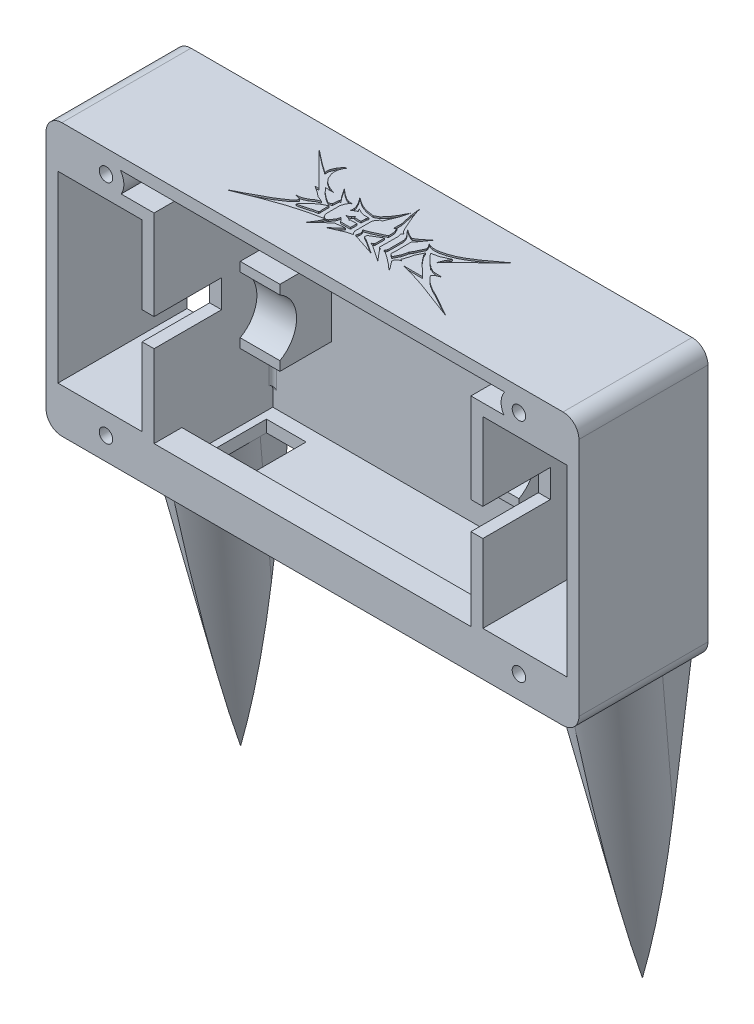
from build123d import *

# Parameters (mm, degrees)
BASE_FOOTPRINT_W                   = 134.2
BASE_FOOTPRINT_H                   = 68.4
UNBROKEN_FLOOR_DEPTH               = 2.6
SHELL_PROFILE_W                    = 134.2
SHELL_PROFILE_H                    = 68.4
SHELL_PROFILE_W_2                  = 128.2
SHELL_PROFILE_H_2                  = 62.4
THREE_MM_PERIMETER_DEPTH           = 32.5
OPEN_WHEEL_WELLS_START             = 36
WHEEL_WELL_PROFILE_W               = 21.2
WHEEL_WELL_PROFILE_H               = 46.2
OPEN_WHEEL_WELLS_DEPTH             = 38
WHEEL_GUARD_PROFILE_W              = 3
WHEEL_GUARD_PROFILE_H              = 46.2
INNER_WHEEL_GUARDS_DEPTH           = 32.5
WHEEL_RETURN_PROFILE_W             = 24.2
WHEEL_RETURN_PROFILE_H             = 3
WHEEL_RETURN_RIBS_DEPTH            = 32.5
OPEN_SHAFT_NOTCHES_START           = 32.5
SHAFT_DROP_IN_PROFILE_W            = 3.7
SHAFT_DROP_IN_PROFILE_H            = 7
OPEN_SHAFT_NOTCHES_DEPTH           = 17
LOWER_CRADLE_BLOCKS_PROFILE_W      = 10
LOWER_CRADLE_BLOCKS_PROFILE_H      = 19
LOWER_MOTOR_CRADLES_DEPTH          = 15.6
LOWER_CRADLE_SEATS_R8P2_START      = 36
LOWER_CRADLE_RADIUS_PROFILE_R      = 8.2
LOWER_CRADLE_SEATS_R8P2_DEPTH      = 72
BATTERY_SIDE_GUIDES_PROFILE_W      = 3
BATTERY_SIDE_GUIDES_PROFILE_H      = 21.2
BATTERY_SIDE_GUIDES_DEPTH          = 5.6
LID_SCREW_BOSS_PROFILE_R           = 4.5
REINFORCED_M3_BOSSES_DEPTH         = 32.5
M3_THROUGH_HOLES_START             = 35.5
M3_THROUGH_HOLES_PROFILE_R         = 1.7
M3_THROUGH_HOLES_DEPTH             = 36
M3_HEX_NUT_POCKETS_UNDERSIDE_START = 2.6
M3_HEX_NUT_POCKETS_UNDERSIDE_DEPTH = 2.7
OUTER_CORNERS_R4_R                 = 4
INNER_CORNERS_R1_R                 = 1
WHEEL_RETURN_ROOT_FILLETS_R1_R     = 1
VIPER_REAR_ENGRAVED_START          = 34.2
VIPER_REAR_ENGRAVED_DEPTH          = 0.4
SKETCH1_W                          = 8.5
SKETCH1_H                          = 5.1
BOSS_EXTRUDE1_DEPTH                = 32.5
BOSS_EXTRUDE2_DEPTH                = 82.5
BOSS_EXTRUDE2_DEPTH_BACK           = 2
SKETCH2_W                          = 7
SKETCH2_H                          = 7
SKETCH3_W                          = 8.5
SKETCH3_H                          = 5.1
BOSS_EXTRUDE5_DEPTH                = 32.5
SKETCH4_W                          = 10
SKETCH4_H                          = 18
CUT_EXTRUDE1_DEPTH                 = 10
BOSS_EXTRUDE7_DEPTH                = 20
CUT_EXTRUDE3_DEPTH                 = 70
CUT_EXTRUDE3_DEPTH_BACK            = 78
FILLET3_R                          = 12.5


with BuildPart() as part:
    # Base_Footprint → Unbroken_Floor (new body)
    with BuildSketch(Plane.XY):
        Rectangle(BASE_FOOTPRINT_W, BASE_FOOTPRINT_H)
    extrude(amount=UNBROKEN_FLOOR_DEPTH)

    # Shell_Profile → Three_mm_Perimeter (add)
    with BuildSketch(Plane.XY):
        Rectangle(SHELL_PROFILE_W, SHELL_PROFILE_H)
        Rectangle(SHELL_PROFILE_W_2, SHELL_PROFILE_H_2, mode=Mode.SUBTRACT)
    extrude(amount=THREE_MM_PERIMETER_DEPTH)

    # Wheel_Well_Profile → Open_Wheel_Wells (cut)
    with BuildSketch(Plane.XY.offset(OPEN_WHEEL_WELLS_START)):
        with Locations((53.5, 0)):
            Rectangle(WHEEL_WELL_PROFILE_W, WHEEL_WELL_PROFILE_H)
        with Locations((-53.5, 0)):
            Rectangle(WHEEL_WELL_PROFILE_W, WHEEL_WELL_PROFILE_H)
    extrude(amount=-OPEN_WHEEL_WELLS_DEPTH, mode=Mode.SUBTRACT)

    # Wheel_Guard_Profile → Inner_Wheel_Guards (add)
    with BuildSketch(Plane.XY):
        with Locations((41.4, 0)):
            Rectangle(WHEEL_GUARD_PROFILE_W, WHEEL_GUARD_PROFILE_H)
        with Locations((-41.4, 0)):
            Rectangle(WHEEL_GUARD_PROFILE_W, WHEEL_GUARD_PROFILE_H)
    extrude(amount=INNER_WHEEL_GUARDS_DEPTH)

    # Wheel_Return_Profile → Wheel_Return_Ribs (add)
    with BuildSketch(Plane.XY):
        with Locations((-52, -24.6)):
            Rectangle(WHEEL_RETURN_PROFILE_W, WHEEL_RETURN_PROFILE_H)
        with Locations((-52, 24.6)):
            Rectangle(WHEEL_RETURN_PROFILE_W, WHEEL_RETURN_PROFILE_H)
        with Locations((52, -24.6)):
            Rectangle(WHEEL_RETURN_PROFILE_W, WHEEL_RETURN_PROFILE_H)
        with Locations((52, 24.6)):
            Rectangle(WHEEL_RETURN_PROFILE_W, WHEEL_RETURN_PROFILE_H)
    extrude(amount=WHEEL_RETURN_RIBS_DEPTH)

    # Shaft_Drop_In_Profile → Open_Shaft_Notches (cut)
    with BuildSketch(Plane.XY.offset(OPEN_SHAFT_NOTCHES_START)):
        with Locations((-41.35, 0)):
            Rectangle(SHAFT_DROP_IN_PROFILE_W, SHAFT_DROP_IN_PROFILE_H)
        with Locations((41.35, 0)):
            Rectangle(SHAFT_DROP_IN_PROFILE_W, SHAFT_DROP_IN_PROFILE_H)
    extrude(amount=-OPEN_SHAFT_NOTCHES_DEPTH, mode=Mode.SUBTRACT)

    # Lower_Cradle_Blocks_Profile → Lower_Motor_Cradles (add)
    with BuildSketch(Plane.XY):
        with Locations((-30.1, 0)):
            Rectangle(LOWER_CRADLE_BLOCKS_PROFILE_W, LOWER_CRADLE_BLOCKS_PROFILE_H)
        with Locations((30.1, 0)):
            Rectangle(LOWER_CRADLE_BLOCKS_PROFILE_W, LOWER_CRADLE_BLOCKS_PROFILE_H)
    extrude(amount=LOWER_MOTOR_CRADLES_DEPTH)

    # Lower_Cradle_Radius_Profile → Lower_Cradle_Seats_R8p2 (cut)
    with BuildSketch(Plane(origin=(0, 0, 0), x_dir=(0, 0, -1), z_dir=(1, 0, 0)).offset(LOWER_CRADLE_SEATS_R8P2_START)):
        with Locations((-19.6, 0)):
            Circle(LOWER_CRADLE_RADIUS_PROFILE_R)
    extrude(amount=-LOWER_CRADLE_SEATS_R8P2_DEPTH, mode=Mode.SUBTRACT)

    # Battery_Side_Guides_Profile → Battery_Side_Guides (add)
    with BuildSketch(Plane.XY):
        with Locations((-30, 20.6)):
            Rectangle(BATTERY_SIDE_GUIDES_PROFILE_W, BATTERY_SIDE_GUIDES_PROFILE_H)
        with Locations((30, 20.6)):
            Rectangle(BATTERY_SIDE_GUIDES_PROFILE_W, BATTERY_SIDE_GUIDES_PROFILE_H)
    extrude(amount=BATTERY_SIDE_GUIDES_DEPTH)

    # Lid_Screw_Boss_Profile → Reinforced_M3_Bosses (add)
    with BuildSketch(Plane.XY):
        with Locations((-52, -28.5)):
            Circle(LID_SCREW_BOSS_PROFILE_R)
        with Locations((-52, 28.5)):
            Circle(LID_SCREW_BOSS_PROFILE_R)
        with Locations((52, -28.5)):
            Circle(LID_SCREW_BOSS_PROFILE_R)
        with Locations((52, 28.5)):
            Circle(LID_SCREW_BOSS_PROFILE_R)
    extrude(amount=REINFORCED_M3_BOSSES_DEPTH)

    # M3_Through_Holes_Profile → M3_Through_Holes (cut)
    with BuildSketch(Plane.XY.offset(M3_THROUGH_HOLES_START)):
        with Locations(Location((-52, -28.5, 0), (0, 0, 180))):
            Circle(M3_THROUGH_HOLES_PROFILE_R)
        with Locations(Location((-52, 28.5, 0), (0, 0, 180))):
            Circle(M3_THROUGH_HOLES_PROFILE_R)
        with Locations(Location((52, -28.5, 0), (0, 0, 180))):
            Circle(M3_THROUGH_HOLES_PROFILE_R)
        with Locations(Location((52, 28.5, 0), (0, 0, 180))):
            Circle(M3_THROUGH_HOLES_PROFILE_R)
    extrude(amount=-M3_THROUGH_HOLES_DEPTH, mode=Mode.SUBTRACT)

    # Captive_Nut_Pockets_Profile → M3_Hex_Nut_Pockets_Underside (cut)
    with BuildSketch(Plane.XY.offset(M3_HEX_NUT_POCKETS_UNDERSIDE_START)):
        Polygon((-48.709103466, -28.5), (-50.354551733, -25.65), (-53.645448267, -25.65), (-55.290896534, -28.5), (-53.645448267, -31.35), (-50.354551733, -31.35), align=None)
        Polygon((-48.709103466, 28.5), (-50.354551733, 31.35), (-53.645448267, 31.35), (-55.290896534, 28.5), (-53.645448267, 25.65), (-50.354551733, 25.65), align=None)
        Polygon((55.290896534, -28.5), (53.645448267, -25.65), (50.354551733, -25.65), (48.709103466, -28.5), (50.354551733, -31.35), (53.645448267, -31.35), align=None)
        Polygon((55.290896534, 28.5), (53.645448267, 31.35), (50.354551733, 31.35), (48.709103466, 28.5), (50.354551733, 25.65), (53.645448267, 25.65), align=None)
    extrude(amount=-M3_HEX_NUT_POCKETS_UNDERSIDE_DEPTH, mode=Mode.SUBTRACT)

    # Outer_Corners_R4
    outer_corners_r4_edges = [part.edges().sort_by_distance(p)[0] for p in [
        (-67.1, 34.2, 16.25),
        (67.1, 34.2, 16.25),
        (67.1, -34.2, 16.25),
        (-67.1, -34.2, 16.25),
    ]]
    fillet(outer_corners_r4_edges, radius=OUTER_CORNERS_R4_R)

    # Inner_Corners_R1
    inner_corners_r1_edges = [part.edges().sort_by_distance(p)[0] for p in [
        (-64.1, -31.2, 17.55),
        (64.1, -31.2, 17.55),
        (64.1, 31.2, 17.55),
        (-64.1, 31.2, 17.55),
    ]]
    fillet(inner_corners_r1_edges, radius=INNER_CORNERS_R1_R)

    # Wheel_Return_Root_Fillets_R1
    wheel_return_root_fillets_r1_edges = [part.edges().sort_by_distance(p)[0] for p in [
        (-39.9, 0, 2.6),
        (39.9, 0, 2.6),
        (-44.046713369, 26.1, 2.6),
        (44.046713369, -26.1, 2.6),
        (59.953286631, 26.1, 2.6),
        (-59.953286631, -26.1, 2.6),
        (-59.953286631, 26.1, 2.6),
        (59.953286631, -26.1, 2.6),
        (44.046713369, 26.1, 2.6),
        (-44.046713369, -26.1, 2.6),
    ]]
    fillet(wheel_return_root_fillets_r1_edges, radius=WHEEL_RETURN_ROOT_FILLETS_R1_R)

    # VIPER_Wordmark_Native_Profile → VIPER_Rear_Engraved (cut)
    # profile 1 of 4: a face of its own
    with BuildSketch(Plane(origin=(0, 0, 0), x_dir=(1, 0, 0), z_dir=(0, 1, 0)).offset(VIPER_REAR_ENGRAVED_START)):
        Polygon((27.5, -26.323476703), (17.406810036, -22.538530466), (13.897849462, -21.434587814), (11.335125448, -20.764336918), (11.295698925, -20.685483871), (15.948028674, -20.685483871), (14.213261649, -18.950716846), (13.543010753, -18.477598566), (12.32078853, -17.137096774), (11.374551971, -15.875448029), (11.098566308, -15.165770609), (10.073476703, -17.215949821), (10.073476703, -17.649641577), (9.5609319, -19.226702509), (9.363799283, -19.581541219), (9.797491039, -19.818100358), (9.797491039, -19.896953405), (9.521505376, -19.936379928), (9.08781362, -20.212365591), (8.772401434, -20.527777778), (8.614695341, -20.843189964), (8.654121864, -21.237455197), (9.758064516, -22.656810036), (10.310035842, -23.445340502), (10.270609319, -23.524193548), (9.127240143, -22.459677419), (7.155913978, -20.922043011), (5.97311828, -20.133512545), (5.224014337, -19.857526882), (5.421146953, -19.620967742), (5.61827957, -19.068996416), (5.61827957, -15.244623656), (5.539426523, -14.850358423), (5.224014337, -14.022401434), (3.686379928, -12.248207885), (5.02688172, -13.155017921), (5.97311828, -13.628136201), (6.249103943, -13.667562724), (7.471326165, -12.879032258), (9.32437276, -11.341397849), (7.668458781, -13.706989247), (6.919354839, -14.57437276), (6.958781362, -18.122759857), (6.879928315, -19.581541219), (7.629032258, -20.251792115), (8.456989247, -18.595878136), (8.85125448, -17.018817204), (9.284946237, -16.309139785), (10.349462366, -14.022401434), (10.191756272, -13.588709677), (9.639784946, -12.721326165), (10.231182796, -12.997311828), (10.901433692, -13.155017921), (12.123655914, -13.155017921), (13.976702509, -12.721326165), (15.711469534, -12.051075269), (17.367383513, -11.183691756), (19.535842294, -9.803763441), (24.26702509, -6.334229391), (20.048387097, -10.474014337), (17.406810036, -12.918458781), (15.593189964, -14.732078853), (14.686379928, -15.836021505), (14.646953405, -15.717741935), (15.080645161, -14.613799283), (15.869175627, -13.155017921), (13.621863799, -14.180107527), (11.768817204, -14.57437276), (13.503584229, -16.466845878), (14.410394265, -17.215949821), (14.725806452, -17.373655914), (15.001792115, -17.767921147), (15.120071685, -17.6890681), (15.908602151, -18.122759857), (16.5, -18.28046595), (18.471326165, -18.359318996), (17.209677419, -18.871863799), (16.815412186, -19.147849462), (16.657706093, -19.384408602), (17.130824373, -20.094086022), (18.550179211, -21.355734767), (20.08781362, -22.301971326), (21.310035842, -22.893369176), align=None)
    # profile 2 of 4: a face of its own
    with BuildSketch(Plane(origin=(0, 0, 0), x_dir=(1, 0, 0), z_dir=(0, 1, 0)).offset(VIPER_REAR_ENGRAVED_START)):
        Polygon((-27.421146953, -26.284050179), (-27.5, -26.284050179), (-27.460573477, -26.205197133), (-25.016129032, -24.98297491), (-19.96953405, -22.22311828), (-17.603942652, -20.646057348), (-16.697132616, -19.778673835), (-16.421146953, -19.344982079), (-16.894265233, -19.108422939), (-18.077060932, -18.793010753), (-17.130824373, -18.753584229), (-16.302867384, -18.556451613), (-15.396057348, -18.122759857), (-14.252688172, -17.334229391), (-13.306451613, -16.979390681), (-14.331541219, -16.506272401), (-14.607526882, -16.466845878), (-15.790322581, -15.520609319), (-17.406810036, -14.495519713), (-16.421146953, -14.495519713), (-24.621863799, -6.255376344), (-24.621863799, -6.176523297), (-24.464157706, -6.255376344), (-21.546594982, -8.542114695), (-19.141577061, -10.237455197), (-19.181003584, -9.409498208), (-19.102150538, -8.975806452), (-18.629032258, -7.871863799), (-18.116487455, -7.16218638), (-17.091397849, -6.176523297), (-17.761648746, -7.359318996), (-18.037634409, -8.187275986), (-18.077060932, -9.251792115), (-17.958781362, -9.803763441), (-17.367383513, -11.22311828), (-16.61827957, -12.051075269), (-15.711469534, -12.681899642), (-14.844086022, -13.115591398), (-13.700716846, -13.509856631), (-14.922939068, -13.549283154), (-15.829749104, -13.391577061), (-14.686379928, -14.613799283), (-13.306451613, -15.717741935), (-12.084229391, -16.466845878), (-11.335125448, -16.112007168), (-11.256272401, -14.613799283), (-11.216845878, -14.45609319), (-10.940860215, -14.416666667), (-11.808243728, -13.312724014), (-13.109318996, -11.380824373), (-11.768817204, -12.484767025), (-10.664874552, -13.233870968), (-9.797491039, -13.588709677), (-8.85125448, -13.628136201), (-9.363799283, -14.10125448), (-9.639784946, -14.495519713), (-9.994623656, -15.520609319), (-9.994623656, -19.147849462), (-9.639784946, -19.896953405), (-9.048387097, -20.330645161), (-12.872759857, -21.158602151), (-16.85483871, -22.301971326), (-21.231182796, -23.839605735), align=None)
        Polygon((-15.908602151, -20.685483871), (-15.790322581, -20.724910394), (-14.568100358, -20.448924731), (-12.399641577, -19.818100358), (-11.374551971, -19.620967742), (-11.256272401, -19.305555556), (-11.335125448, -18.911290323), (-11.335125448, -17.018817204), (-12.636200717, -17.649641577), (-13.818996416, -18.51702509), align=None, mode=Mode.SUBTRACT)
    # profile 3 of 4: a face of its own
    with BuildSketch(Plane(origin=(0, 0, 0), x_dir=(1, 0, 0), z_dir=(0, 1, 0)).offset(VIPER_REAR_ENGRAVED_START)):
        Polygon((-10.586021505, -23.563620072), (-10.625448029, -23.484767025), (-9.44265233, -21.63172043), (-8.85125448, -20.291218638), (-8.575268817, -20.291218638), (-8.378136201, -20.133512545), (-7.550179211, -18.911290323), (-7.274193548, -18.004480287), (-6.367383513, -19.029569892), (-3.922939068, -19.029569892), (-3.922939068, -17.373655914), (-5.578853047, -17.413082437), (-5.61827957, -17.767921147), (-5.775985663, -17.531362007), (-6.130824373, -17.294802867), (-7.155913978, -16.979390681), (-6.603942652, -16.821684588), (-6.130824373, -16.545698925), (-5.61827957, -15.993727599), (-5.539426523, -16.387992832), (-3.922939068, -16.348566308), (-3.883512545, -15.086917563), (-3.686379928, -14.613799283), (-4.632616487, -14.653225806), (-5.5, -14.534946237), (-6.801075269, -13.904121864), (-6.603942652, -14.377240143), (-6.367383513, -14.45609319), (-6.367383513, -14.534946237), (-6.958781362, -14.8109319), (-7.707885305, -15.402329749), (-7.589605735, -14.968637993), (-7.589605735, -14.298387097), (-7.786738351, -13.628136201), (-8.338709677, -12.563620072), (-9.245519713, -11.301971326), (-7.707885305, -12.405913978), (-6.682795699, -12.918458781), (-5.460573477, -13.312724014), (-3.607526882, -13.588709677), (-2.543010753, -12.997311828), (-1.55734767, -11.972222222), (-0.413978495, -10.237455197), (0.650537634, -8.068996416), (-0.098566308, -10.710573477), (-1.360215054, -13.706989247), (-1.517921147, -13.588709677), (-1.754480287, -13.706989247), (-2.109318996, -14.10125448), (-2.582437276, -14.889784946), (-2.582437276, -19.226702509), (-2.345878136, -19.778673835), (-1.951612903, -20.172939068), (-3.410394265, -20.567204301), (-7.195340502, -22.22311828), (-5.97311828, -21.27688172), (-4.396057348, -19.857526882), (-4.396057348, -19.778673835), (-5.14516129, -19.818100358), (-6.879928315, -20.094086022), (-8.73297491, -21.671146953), align=None)
    # profile 4 of 4: a face of its own
    with BuildSketch(Plane(origin=(0, 0, 0), x_dir=(1, 0, 0), z_dir=(0, 1, 0)).offset(VIPER_REAR_ENGRAVED_START)):
        Polygon((6.840501792, -22.893369176), (3.252688172, -20.488351254), (3.134408602, -20.330645161), (2.069892473, -19.857526882), (2.503584229, -19.660394265), (2.700716846, -19.423835125), (2.700716846, -17.018817204), (-0.059139785, -18.674731183), (-0.098566308, -19.305555556), (0.887096774, -19.818100358), (4.356630824, -22.065412186), (-1.399641577, -20.172939068), (-1.636200717, -20.015232975), (-1.399641577, -19.344982079), (-1.399641577, -18.793010753), (-1.55734767, -18.359318996), (-1.79390681, -18.083333333), (-1.754480287, -18.004480287), (-0.295698925, -17.452508961), (2.700716846, -16.033154122), (2.661290323, -14.653225806), (2.503584229, -14.061827957), (2.227598566, -13.706989247), (2.188172043, -13.431003584), (1.67562724, -13.746415771), (1.754480287, -11.853942652), (1.123655914, -8.896953405), (0.808243728, -6.413082437), (0.887096774, -6.452508961), (1.044802867, -7.16218638), (1.715053763, -9.015232975), (3.055555556, -12.129928315), (3.686379928, -13.312724014), (4.080645161, -13.628136201), (4.277777778, -13.667562724), (3.883512545, -14.10125448), (4.080645161, -15.008064516), (4.041218638, -19.620967742), (4.238351254, -19.818100358), (4.474910394, -19.896953405), (5.02688172, -20.724910394), align=None)
    extrude(amount=-VIPER_REAR_ENGRAVED_DEPTH, mode=Mode.SUBTRACT)

    # Sketch1 → Boss-Extrude1 (add)
    with BuildSketch(Plane.XY):
        with Locations((-44.15, -28.65)):
            Rectangle(SKETCH1_W, SKETCH1_H)
        with Locations((44.15, -28.65)):
            Rectangle(SKETCH1_W, SKETCH1_H)
    extrude(amount=BOSS_EXTRUDE1_DEPTH)

    # Sketch2 → Boss-Extrude2 (add, two sides: drawn at the far end of the back side and taken through both)
    with BuildSketch(Plane(origin=(-39.9, 0, 0), x_dir=(0, 0, -1), z_dir=(1, 0, 0)).offset(-BOSS_EXTRUDE2_DEPTH_BACK)):
        with Locations((-29, -27.7)):
            Rectangle(SKETCH2_W, SKETCH2_H)
    extrude(amount=BOSS_EXTRUDE2_DEPTH + BOSS_EXTRUDE2_DEPTH_BACK)

    # Sketch3 → Boss-Extrude5 (add)
    with BuildSketch(Plane.XY):
        with Locations((-59.85, 28.65)):
            Rectangle(SKETCH3_W, SKETCH3_H)
        with Locations((-59.85, -28.65)):
            Rectangle(SKETCH3_W, SKETCH3_H)
        with Locations((59.85, -28.65)):
            Rectangle(SKETCH3_W, SKETCH3_H)
        with Locations((59.85, 28.65)):
            Rectangle(SKETCH3_W, SKETCH3_H)
    extrude(amount=BOSS_EXTRUDE5_DEPTH)

    # Sketch4 → Cut-Extrude1 (cut)
    with BuildSketch(Plane.XZ.offset(34.2)):
        with Locations((-33.1, 15)):
            Rectangle(SKETCH4_W, SKETCH4_H)
    extrude(amount=-CUT_EXTRUDE1_DEPTH, mode=Mode.SUBTRACT)

    # Sketch6 → Boss-Extrude7 (add)
    with BuildSketch(Plane.XY):
        Polygon((-38.1, -34.2), (-63.1, -34.2), (-50.6, -134.2), align=None)
        Polygon((38.1, -34.2), (63.1, -34.2), (50.6, -134.2), align=None)
    extrude(amount=BOSS_EXTRUDE7_DEPTH)

    # Sketch8 → Cut-Extrude3 (cut, two sides: drawn at the far end of the back side and taken through both)
    with BuildSketch(Plane(origin=(0, 0, 0), x_dir=(0, 0, -1), z_dir=(1, 0, 0)).offset(-CUT_EXTRUDE3_DEPTH_BACK)):
        Polygon((-20, -34.2), (0, -134.2), (-20, -134.2), align=None)
    extrude(amount=CUT_EXTRUDE3_DEPTH + CUT_EXTRUDE3_DEPTH_BACK, mode=Mode.SUBTRACT)

    # Fillet3
    # the kernel refuses this fillet: 12.5 mm, written as the material it takes off along each edge
    with BuildSketch(Plane(origin=(-46.889445532, -163.884435748, -5.93688715), x_dir=(0.9925715803982743, 0.11929946879786957, 0.023859893759573824), z_dir=(-0.1216620638723181, 0.9732965109785444, 0.19465930219570882))) as fillet3_piece_1_section:
        with BuildLine():
            CenterArc((FILLET3_R * 0.975963576576, FILLET3_R), FILLET3_R, 181.393869513, 88.606130487)
            Line((-FILLET3_R * 0.0237405216565, FILLET3_R * 0.975674787229), (0, 0))
            Line((0, 0), (FILLET3_R * 0.975963576576, 0))
        make_face()
    fillet3_piece_1 = extrude(amount=163.741336476, mode=Mode.PRIVATE)
    fillet3_piece_1 = split(fillet3_piece_1, bisect_by=Plane(origin=(-55.330411696, -34.2, 9.275388844), z_dir=(0, -1, 0)), keep=Keep.TOP, mode=Mode.PRIVATE)
    add(fillet3_piece_1, mode=Mode.SUBTRACT)
    with BuildSketch(Plane(origin=(34.389445532, -4.515564252, 25.93688715), x_dir=(0.9925715803982743, 0.11929946879786935, 0.02385989375957387), z_dir=(0.12166206387231789, -0.9732965109785444, -0.19465930219570884))) as fillet3_piece_2_section:
        with BuildLine():
            CenterArc((FILLET3_R * 0.975963576576, -FILLET3_R), FILLET3_R, 90, 88.606130487)
            Line((-FILLET3_R * 0.0237405216565, -FILLET3_R * 0.975674787229), (0, 0))
            Line((0, 0), (FILLET3_R * 0.975963576576, 0))
        make_face()
    fillet3_piece_2 = extrude(amount=163.741336476, mode=Mode.PRIVATE)
    fillet3_piece_2 = split(fillet3_piece_2, bisect_by=Plane(origin=(45.360034624, -34.2, 17.268245761), z_dir=(0, -1, 0)), keep=Keep.TOP, mode=Mode.PRIVATE)
    add(fillet3_piece_2, mode=Mode.SUBTRACT)
    with BuildSketch(Plane(origin=(-34.389445532, -4.515564252, 25.93688715), x_dir=(0.024144514883164693, 0.1931561190653222, -0.9808709171285891), z_dir=(-0.12166206387231789, -0.9732965109785444, -0.19465930219570884))) as fillet3_piece_3_section:
        with BuildLine():
            CenterArc((FILLET3_R * 0.975963576576, -FILLET3_R), FILLET3_R, 90, 88.606130487)
            Line((-FILLET3_R * 0.0237405216565, -FILLET3_R * 0.975674787229), (0, 0))
            Line((0, 0), (FILLET3_R * 0.975963576576, 0))
        make_face()
    fillet3_piece_3 = extrude(amount=163.741336476, mode=Mode.PRIVATE)
    fillet3_piece_3 = split(fillet3_piece_3, bisect_by=Plane(origin=(-39.271677031, -34.2, 12.559914386), z_dir=(0, -1, 0)), keep=Keep.TOP, mode=Mode.PRIVATE)
    add(fillet3_piece_3, mode=Mode.SUBTRACT)
    with BuildSketch(Plane(origin=(46.889445532, -163.884435748, -5.93688715), x_dir=(0.024144514883164693, 0.1931561190653222, -0.9808709171285893), z_dir=(0.1216620638723181, 0.9732965109785444, 0.19465930219570882))) as fillet3_piece_4_section:
        with BuildLine():
            CenterArc((FILLET3_R * 0.975963576576, FILLET3_R), FILLET3_R, 181.393869513, 88.606130487)
            Line((-FILLET3_R * 0.0237405216565, FILLET3_R * 0.975674787229), (0, 0))
            Line((0, 0), (FILLET3_R * 0.975963576576, 0))
        make_face()
    fillet3_piece_4 = extrude(amount=163.741336476, mode=Mode.PRIVATE)
    fillet3_piece_4 = split(fillet3_piece_4, bisect_by=Plane(origin=(55.330411696, -34.2, 9.275388844), z_dir=(0, -1, 0)), keep=Keep.TOP, mode=Mode.PRIVATE)
    add(fillet3_piece_4, mode=Mode.SUBTRACT)


solid = part.part
